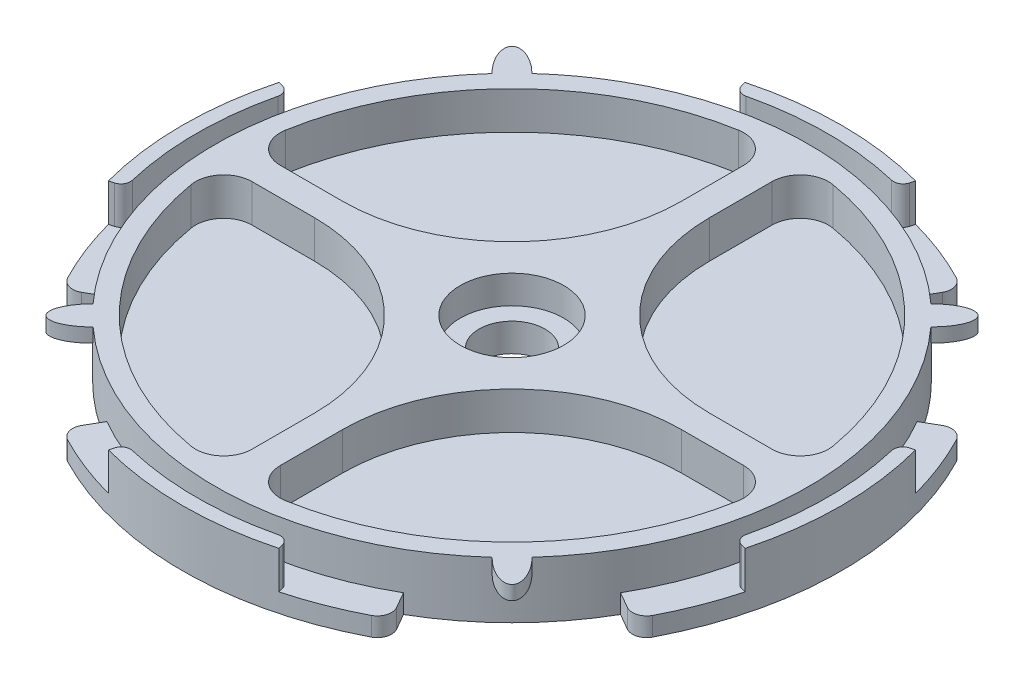
from build123d import *

# Parameters (mm, degrees)
SKETCH1_R                                           = 35
BOSS_EXTRUDE1_DEPTH                                 = 2
SKETCH2_R                                           = 31.5
BOSS_EXTRUDE2_DEPTH                                 = 4
SKETCH4_R                                           = 35
SKETCH4_R_2                                         = 33.5
BOSS_EXTRUDE3_DEPTH                                 = 4
CUT_EXTRUDE2_START                                  = -6
CUT_EXTRUDE2_DEPTH                                  = 6
CUT_EXTRUDE3_START                                  = -4
CUT_EXTRUDE3_DEPTH                                  = 4
SKETCH7_RX                                          = 3.5
SKETCH7_RY                                          = 1.5
BOSS_EXTRUDE4_DEPTH                                 = 1.5
CUT_EXTRUDE1_DEPTH                                  = 4
FILLET1_R                                           = 18
FILLET2_R                                           = 3
FILLET3_R                                           = 1.5
FILLET4_R                                           = 1
CIRPATTERN1_COUNT                                   = 4
FILLET1_OF_CIRPATTERN1_R                            = 18
FILLET2_OF_CIRPATTERN1_R                            = 3
FILLET3_OF_CIRPATTERN1_R                            = 1.5
FILLET4_OF_CIRPATTERN1_R                            = 1
CBORE_FOR_M6_HEX_SOCKET_HEAD_CAP_SCREW1_D           = 7
CBORE_FOR_M6_HEX_SOCKET_HEAD_CAP_SCREW1_CBORE_D     = 11
CBORE_FOR_M6_HEX_SOCKET_HEAD_CAP_SCREW1_CBORE_DEPTH = 3


# Read off the part's stored shape, not the designer's step: Cut-Extrude2
with BuildPart() as part:
    # Sketch1 → Boss-Extrude1 (new body)
    with BuildSketch(Plane(origin=(0, 0, 0), x_dir=(1, 0, 0), z_dir=(0, 1, 0))):
        with Locations(Location((0, 0, 0), (0, 0, 270))):
            Circle(SKETCH1_R)
    extrude(amount=BOSS_EXTRUDE1_DEPTH)

    # Sketch2 → Boss-Extrude2 (add)
    with BuildSketch(Plane(origin=(0, 2, 0), x_dir=(1, 0, 0), z_dir=(0, 1, 0))):
        with Locations(Location((0, 0, 0), (0, 0, 270))):
            Circle(SKETCH2_R)
    extrude(amount=BOSS_EXTRUDE2_DEPTH)

    # Sketch4 → Boss-Extrude3 (add)
    with BuildSketch(Plane(origin=(0, 2, 0), x_dir=(1, 0, 0), z_dir=(0, 1, 0))):
        with Locations(Location((0, 0, 0), (0, 0, 270))):
            Circle(SKETCH4_R)
        with Locations(Location((0, 0, 0), (0, 0, 270))):
            Circle(SKETCH4_R_2, mode=Mode.SUBTRACT)
    extrude(amount=BOSS_EXTRUDE3_DEPTH)

    # Cut-Extrude2 outline → Cut-Extrude2 (cut)
    with BuildSketch(Plane(origin=(0, 6, 0), x_dir=(1, 0, 0), z_dir=(0, 1, 0)).offset(CUT_EXTRUDE2_START)):
        with BuildLine():
            ThreePointArc((30.310889132, 17.5), (24.748737342, 24.748737342), (17.5, 30.310889132))
            Line((17.5, 30.310889132), (15.75, 27.279800219))
            ThreePointArc((15.75, 27.279800219), (22.273863607, 22.273863607), (27.279800219, 15.75))
            Line((27.279800219, 15.75), (30.310889132, 17.5))
        make_face()
    cut_extrude2 = extrude(amount=CUT_EXTRUDE2_DEPTH, mode=Mode.SUBTRACT)

    # Sketch6 → Cut-Extrude3 (cut)
    with BuildSketch(Plane(origin=(0, 6, 0), x_dir=(1, 0, 0), z_dir=(0, 1, 0)).offset(CUT_EXTRUDE3_START)):
        with BuildLine():
            Line((8.152799921, 30.426663528), (9.058666579, 33.80740392))
            ThreePointArc((9.058666579, 33.80740392), (24.748737342, 24.748737342), (33.80740392, 9.058666579))
            Line((33.80740392, 9.058666579), (30.426663528, 8.152799921))
            ThreePointArc((30.426663528, 8.152799921), (22.273863607, 22.273863607), (8.152799921, 30.426663528))
        make_face()
    cut_extrude3 = extrude(amount=CUT_EXTRUDE3_DEPTH, mode=Mode.SUBTRACT)

    # Sketch7 → Boss-Extrude4 (add)
    with BuildSketch(Plane(origin=(0, 6, 0), x_dir=(1, 0, 0), z_dir=(0, 1, 0))):
        with Locations(Location((22.273863607, 22.273863607), (0, 0, 45))):
            Ellipse(SKETCH7_RX, SKETCH7_RY)
    boss_extrude4 = extrude(amount=-BOSS_EXTRUDE4_DEPTH)

    # Sketch3 → Cut-Extrude1 (cut)
    with BuildSketch(Plane(origin=(0, 6, 0), x_dir=(1, 0, 0), z_dir=(0, 1, 0))):
        with BuildLine():
            Line((1.5, 1.5), (1.5, 29.461839725))
            ThreePointArc((1.5, 29.461839725), (20.859650045, 20.859650045), (29.461839725, 1.5))
            Line((29.461839725, 1.5), (1.5, 1.5))
        make_face()
    cut_extrude1 = extrude(amount=-CUT_EXTRUDE1_DEPTH, mode=Mode.SUBTRACT)

    # Fillet1
    fillet1_edges = [part.edges().sort_by_distance(p)[0] for p in [
        (1.5, 4, -1.5),
    ]]
    fillet(fillet1_edges, radius=FILLET1_R)

    # Fillet2
    fillet2_edges = [part.edges().sort_by_distance(p)[0] for p in [
        (29.461839725, 4, -1.5),
        (1.5, 4, -29.461839725),
    ]]
    fillet(fillet2_edges, radius=FILLET2_R)

    # Fillet3
    fillet3_edges = [part.edges().sort_by_distance(p)[0] for p in [
        (17.5, 1, -30.310889132),
        (30.310889132, 1, -17.5),
    ]]
    fillet(fillet3_edges, radius=FILLET3_R)

    # Fillet4
    fillet4_edges = [part.edges().sort_by_distance(p)[0] for p in [
        (8.670438011, 4, -32.358515181),
        (32.358515181, 4, -8.670438011),
    ]]
    fillet(fillet4_edges, radius=FILLET4_R)

    # CirPattern1: Cut-Extrude2, Cut-Extrude3, Boss-Extrude4, Cut-Extrude1 ×4 about axis
    cirpattern1_axis = Axis((0, 6, 0), (0, -1, 0))
    add([cut_extrude2.rotate(cirpattern1_axis, i * 360 / CIRPATTERN1_COUNT) for i in range(1, CIRPATTERN1_COUNT)], mode=Mode.SUBTRACT)
    add([cut_extrude3.rotate(cirpattern1_axis, i * 360 / CIRPATTERN1_COUNT) for i in range(1, CIRPATTERN1_COUNT)], mode=Mode.SUBTRACT)
    add([boss_extrude4.rotate(cirpattern1_axis, i * 360 / CIRPATTERN1_COUNT) for i in range(1, CIRPATTERN1_COUNT)])
    add([cut_extrude1.rotate(cirpattern1_axis, i * 360 / CIRPATTERN1_COUNT) for i in range(1, CIRPATTERN1_COUNT)], mode=Mode.SUBTRACT)

    # Fillet1 of CirPattern1
    fillet1_of_cirpattern1_edges = [part.edges().sort_by_distance(p)[0] for p in [
        (1.5, 4, 1.5),
        (-1.5, 4, 1.5),
        (-1.5, 4, -1.5),
    ]]
    fillet(fillet1_of_cirpattern1_edges, radius=FILLET1_OF_CIRPATTERN1_R)

    # Fillet2 of CirPattern1
    fillet2_of_cirpattern1_edges = [part.edges().sort_by_distance(p)[0] for p in [
        (1.5, 4, 29.461839725),
        (29.461839725, 4, 1.5),
        (-29.461839725, 4, 1.5),
        (-1.5, 4, 29.461839725),
        (-1.5, 4, -29.461839725),
        (-29.461839725, 4, -1.5),
    ]]
    fillet(fillet2_of_cirpattern1_edges, radius=FILLET2_OF_CIRPATTERN1_R)

    # Fillet3 of CirPattern1
    fillet3_of_cirpattern1_edges = [part.edges().sort_by_distance(p)[0] for p in [
        (30.310889132, 1, 17.5),
        (17.5, 1, 30.310889132),
        (-17.5, 1, 30.310889132),
        (-30.310889132, 1, 17.5),
        (-30.310889132, 1, -17.5),
        (-17.5, 1, -30.310889132),
    ]]
    fillet(fillet3_of_cirpattern1_edges, radius=FILLET3_OF_CIRPATTERN1_R)

    # Fillet4 of CirPattern1
    fillet4_of_cirpattern1_edges = [part.edges().sort_by_distance(p)[0] for p in [
        (32.358515181, 4, 8.670438011),
        (8.670438011, 4, 32.358515181),
        (-8.670438011, 4, 32.358515181),
        (-32.358515181, 4, 8.670438011),
        (-32.358515181, 4, -8.670438011),
        (-8.670438011, 4, -32.358515181),
    ]]
    fillet(fillet4_of_cirpattern1_edges, radius=FILLET4_OF_CIRPATTERN1_R)

    # CBORE for M6 Hex Socket Head Cap Screw1 (through all)
    with Locations(Plane(origin=(0, 6, 0), x_dir=(1, 0, 0), z_dir=(0, 1, 0))):
        with Locations((0, 0)):
            CounterBoreHole(CBORE_FOR_M6_HEX_SOCKET_HEAD_CAP_SCREW1_D / 2, CBORE_FOR_M6_HEX_SOCKET_HEAD_CAP_SCREW1_CBORE_D / 2, CBORE_FOR_M6_HEX_SOCKET_HEAD_CAP_SCREW1_CBORE_DEPTH)


solid = part.part
